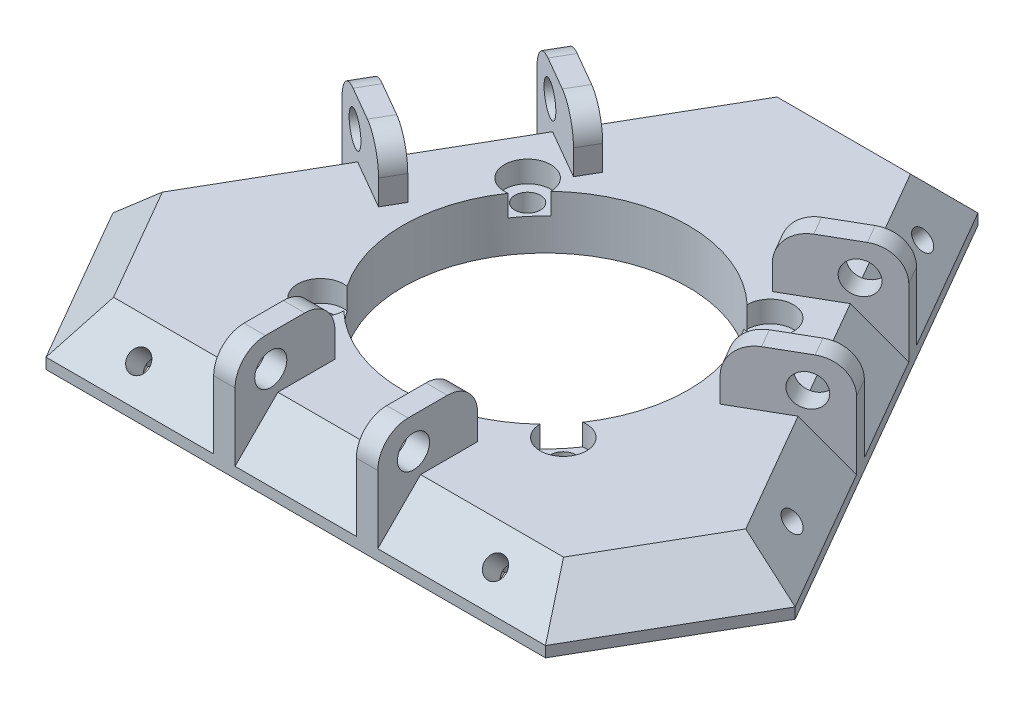
from build123d import *

# Parameters (mm, degrees)
SKETCH1_R                      = 20
BOSS_EXTRUDE1_DEPTH            = 7.5
CHAMFER2_SIZE                  = 6
CBORE_FOR_M3_SHCS1_D           = 3.6
CBORE_FOR_M3_SHCS1_CBORE_D     = 6.5
CBORE_FOR_M3_SHCS1_CBORE_DEPTH = 3
CUT_EXTRUDE1_REACH             = 99.961
SKETCH4_R                      = 1.5
CUT_EXTRUDE2_START             = -3.5
CUT_EXTRUDE2_DEPTH             = 10
SKETCH7_R                      = 1.5
CUT_EXTRUDE3_DEPTH             = 10
CUT_EXTRUDE4_START             = -3.5
CUT_EXTRUDE4_DEPTH             = 10
SKETCH9_R                      = 1.5
CUT_EXTRUDE5_DEPTH             = 10
CUT_EXTRUDE6_START             = -3.5
CUT_EXTRUDE6_DEPTH             = 10
SKETCH11_W                     = 3
SKETCH11_H                     = 14
BOSS_EXTRUDE2_DEPTH            = 15.25
SKETCH12_R                     = 2.25
CUT_EXTRUDE7_DEPTH             = 121.567333403
FILLET1_R                      = 4.25
FILLET1_OF_MIRROR4_R           = 4.25
FILLET1_OF_MIRROR5_R           = 4.25


with BuildPart() as part:
    # Sketch1 → Boss-Extrude1 (new body)
    with BuildSketch(Plane(origin=(0, 42.804564232, 0), x_dir=(1, 0, 0), z_dir=(0, 1, 0))):
        Polygon((72.89779828, -65.265836883), (37.89779828, -4.644058618), (12.276020015, -4.644058618), (-22.723979985, -65.265836883), (-9.913090852, -87.454947751), (60.086909148, -87.454947751), align=None)
        with Locations((25.086909148, -52.454947751)):
            Circle(SKETCH1_R, mode=Mode.SUBTRACT)
    extrude(amount=BOSS_EXTRUDE1_DEPTH)

    # Chamfer2
    chamfer2_edges = [part.edges().sort_by_distance(p)[0] for p in [
        (55.39779828, 50.304564232, 34.954947751),
        (66.492353714, 50.304564232, 76.360392317),
        (25.086909148, 50.304564232, 87.454947751),
        (-16.318535418, 50.304564232, 76.360392317),
        (-5.223979985, 50.304564232, 34.954947751),
        (25.086909148, 50.304564232, 4.644058618),
    ]]
    chamfer(chamfer2_edges, length=CHAMFER2_SIZE)

    # CBORE for M3 SHCS1 (through all)
    with Locations(Plane(origin=(0, 50.304564232, 0), x_dir=(1, 0, 0), z_dir=(0, 1, 0))):
        with Locations((8.086909148, -37.954947751), (42.086909148, -37.954947751), (42.086909148, -66.954947751), (8.086909148, -66.954947751)):
            CounterBoreHole(CBORE_FOR_M3_SHCS1_D / 2, CBORE_FOR_M3_SHCS1_CBORE_D / 2, CBORE_FOR_M3_SHCS1_CBORE_DEPTH)

    # Sketch4 → Cut-Extrude1 (cut, up to next)
    with BuildSketch(Plane(origin=(0, 65.879755991, 65.879755991), x_dir=(1, 0, 0), z_dir=(0, 0.707106781186546, 0.707106781186549)), mode=Mode.PRIVATE) as cut_extrude1_sk1:
        with Locations((0.086909148, -26.26928811)):
            Circle(SKETCH4_R)
    cut_extrude1_tool1 = extrude(cut_extrude1_sk1.sketch, amount=-CUT_EXTRUDE1_REACH, mode=Mode.PRIVATE) & part.part
    # Sketch4 → Cut-Extrude1 (cut, up to next)
    with BuildSketch(Plane(origin=(0, 65.879755991, 65.879755991), x_dir=(1, 0, 0), z_dir=(0, 0.707106781186546, 0.707106781186549)), mode=Mode.PRIVATE) as cut_extrude1_sk2:
        with Locations((50.086909148, -26.26928811)):
            Circle(SKETCH4_R)
    cut_extrude1_tool2 = extrude(cut_extrude1_sk2.sketch, amount=-CUT_EXTRUDE1_REACH, mode=Mode.PRIVATE) & part.part
    add(cut_extrude1_tool1.solids().sort_by_distance((0.086909, 47.304564, 84.454948))[0], mode=Mode.SUBTRACT)
    add(cut_extrude1_tool2.solids().sort_by_distance((50.086909, 47.304564, 84.454948))[0], mode=Mode.SUBTRACT)

    # Sketch5 → Cut-Extrude2 (cut)
    with BuildSketch(Plane(origin=(0, 65.879755991, 65.879755991), x_dir=(1, 0, 0), z_dir=(0, 0.707106781186546, 0.707106781186549)).offset(CUT_EXTRUDE2_START)):
        Polygon((3.262335628, -26.26928811), (1.674622388, -23.51928811), (-1.500804092, -23.51928811), (-3.088517333, -26.26928811), (-1.500804092, -29.01928811), (1.674622388, -29.01928811), align=None)
        Polygon((48.499195908, -29.01928811), (46.911482667, -26.26928811), (48.499195908, -23.51928811), (51.674622388, -23.51928811), (53.262335628, -26.26928811), (51.674622388, -29.01928811), align=None)
    extrude(amount=-CUT_EXTRUDE2_DEPTH, mode=Mode.SUBTRACT)

    # Sketch7 → Cut-Extrude3 (cut)
    with BuildSketch(Plane(origin=(-13.575463373, 15.675594866, -7.837797433), x_dir=(0.7905694150420939, 0.5477225575051667, -0.2738612787525847), z_dir=(-0.6123724356957958, 0.7071067811865459, -0.35355339059327473))):
        with Locations((29.661607386, -34.396624037)):
            Circle(SKETCH7_R)
        with Locations((-1.961169216, -73.126457499)):
            Circle(SKETCH7_R)
    extrude(amount=-CUT_EXTRUDE3_DEPTH, mode=Mode.SUBTRACT)

    # Sketch8 → Cut-Extrude4 (cut)
    with BuildSketch(Plane(origin=(-13.575463373, 15.675594866, -7.837797433), x_dir=(0.7905694150420939, 0.5477225575051667, -0.2738612787525847), z_dir=(-0.6123724356957958, 0.7071067811865459, -0.35355339059327473)).offset(CUT_EXTRUDE4_START)):
        Polygon((32.795906248, -34.906039363), (31.66992343, -31.936949262), (28.535624567, -31.427533937), (26.527308523, -33.887208712), (27.653291342, -36.856298813), (30.787590204, -37.365714138), align=None)
        Polygon((1.173129647, -73.635872825), (-0.835186398, -76.0955476), (-3.96948526, -75.586132275), (-5.095468078, -72.617042174), (-3.087152034, -70.157367399), (0.047146828, -70.666782724), align=None)
    extrude(amount=-CUT_EXTRUDE4_DEPTH, mode=Mode.SUBTRACT)

    # Sketch9 → Cut-Extrude5 (cut)
    with BuildSketch(Plane(origin=(32.390645234, 37.401495491, -18.700747745), x_dir=(0.790569415042094, -0.5477225575051669, 0.2738612787525843), z_dir=(0.6123724356957958, 0.7071067811865464, -0.3535533905932743))):
        with Locations((41.627055396, -73.126457499)):
            Circle(SKETCH9_R)
        with Locations((10.004278795, -34.396624037)):
            Circle(SKETCH9_R)
    extrude(amount=-CUT_EXTRUDE5_DEPTH, mode=Mode.SUBTRACT)

    # Sketch10 → Cut-Extrude6 (cut)
    with BuildSketch(Plane(origin=(32.390645234, 37.401495491, -18.700747745), x_dir=(0.790569415042094, -0.5477225575051669, 0.2738612787525843), z_dir=(0.6123724356957958, 0.7071067811865464, -0.3535533905932743)).offset(CUT_EXTRUDE6_START)):
        Polygon((39.618739352, -70.666782724), (38.492756534, -73.635872825), (40.501072578, -76.0955476), (43.63537144, -75.586132275), (44.761354259, -72.617042174), (42.753038215, -70.157367399), align=None)
        Polygon((13.138577657, -33.887208712), (12.012594839, -36.856298813), (8.878295976, -37.365714138), (6.869979932, -34.906039363), (7.99596275, -31.936949262), (11.130261613, -31.427533937), align=None)
    extrude(amount=-CUT_EXTRUDE6_DEPTH, mode=Mode.SUBTRACT)

    # Sketch11 → Boss-Extrude2 (add)
    with BuildSketch(Plane(origin=(0, 42.804564232, 0), x_dir=(1, 0, 0), z_dir=(0, 1, 0))):
        with Locations((35.086909148, -80.454947751)):
            Rectangle(SKETCH11_W, SKETCH11_H)
        with Locations((15.086909148, -80.454947751)):
            Rectangle(SKETCH11_W, SKETCH11_H)
    boss_extrude2 = extrude(amount=BOSS_EXTRUDE2_DEPTH)

    # Sketch12 → Cut-Extrude7 (cut, symmetric)
    with BuildSketch(Plane(origin=(36.586909148, 0, 0), x_dir=(0, 0, -1), z_dir=(1, 0, 0))):
        with Locations((-82.454947751, 53.621218058)):
            Circle(SKETCH12_R)
    cut_extrude7 = extrude(amount=CUT_EXTRUDE7_DEPTH, both=True, mode=Mode.SUBTRACT)

    # Fillet1
    fillet1_edges = [part.edges().sort_by_distance(p)[0] for p in [
        (35.086909148, 58.054564232, 73.454947751),
        (35.086909148, 58.054564232, 87.454947751),
        (15.086909148, 58.054564232, 73.454947751),
        (15.086909148, 58.054564232, 87.454947751),
    ]]
    fillet(fillet1_edges, radius=FILLET1_R)

    # Mirror4: Boss-Extrude2, Cut-Extrude7 across plane
    add(boss_extrude2.mirror(Plane(origin=(28.98538594, 0, 50.204161125), x_dir=(-0.8660254037844384, -1.4004233148106769e-14, 0.5000000000000004), z_dir=(0.5000000000000001, 8.085347777853729e-15, 0.8660254037844385))))
    add(cut_extrude7.mirror(Plane(origin=(28.98538594, 0, 50.204161125), x_dir=(-0.8660254037844384, -1.4004233148106769e-14, 0.5000000000000004), z_dir=(0.5000000000000001, 8.085347777853729e-15, 0.8660254037844385))), mode=Mode.SUBTRACT)

    # Fillet1 of Mirror4
    fillet1_of_mirror4_edges = [part.edges().sort_by_distance(p)[0] for p in [
        (11.900375668, 58.054564232, 33.294693713),
        (-0.223979985, 58.054564232, 26.294693713),
        (1.900375668, 58.054564232, 50.615201789),
        (-10.223979985, 58.054564232, 43.615201789),
    ]]
    fillet(fillet1_of_mirror4_edges, radius=FILLET1_OF_MIRROR4_R)

    # Mirror5: Boss-Extrude2, Cut-Extrude7 across plane
    add(boss_extrude2.mirror(Plane(origin=(-16.441931366, 0, 28.478260501), x_dir=(0.8660254037844387, 0, 0.5000000000000001), z_dir=(-0.5000000000000002, 0, 0.8660254037844386))))
    add(cut_extrude7.mirror(Plane(origin=(-16.441931366, 0, 28.478260501), x_dir=(0.8660254037844387, 0, 0.5000000000000001), z_dir=(-0.5000000000000002, 0, 0.8660254037844386))), mode=Mode.SUBTRACT)

    # Fillet1 of Mirror5
    fillet1_of_mirror5_edges = [part.edges().sort_by_distance(p)[0] for p in [
        (48.273442627, 58.054564232, 50.615201789),
        (60.39779828, 58.054564232, 43.615201789),
        (38.273442627, 58.054564232, 33.294693713),
        (50.39779828, 58.054564232, 26.294693713),
    ]]
    fillet(fillet1_of_mirror5_edges, radius=FILLET1_OF_MIRROR5_R)


solid = part.part
